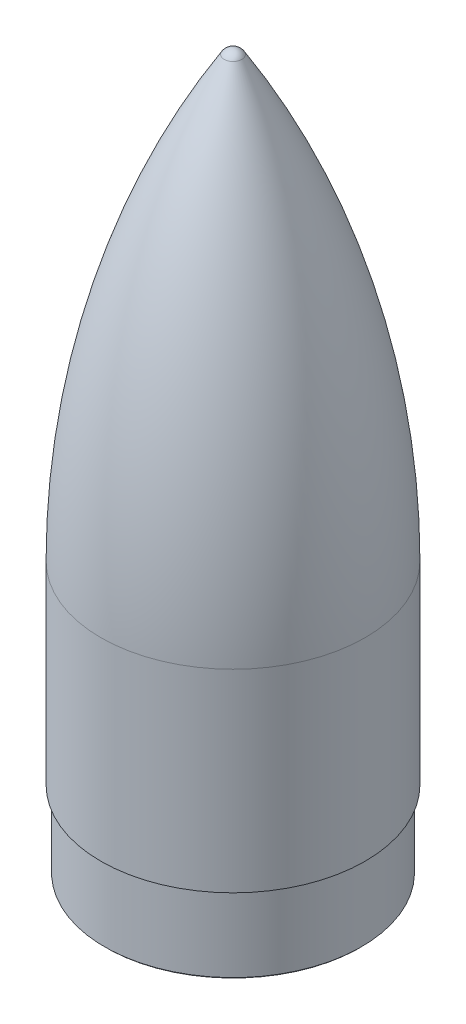
from build123d import *

# Parameters (mm, degrees)
FILLET_751_R                = 3
CHAMFER_848_SIZE            = 0.5
CUT_EXTRUDE_1153_REACH      = 288.307
CUT_EXTRUDE_1153_END_RADIUS = 51.2


# Read off the part's stored shape, not the designer's step: Оболочка1
with BuildPart() as part:
    # Эскиз1 → Revolve 638 (revolve)
    with BuildSketch(Plane.XY, mode=Mode.PRIVATE) as revolve_638_sk:
        with BuildLine():
            Line((49.7, 0), (30.5, 0))
            Line((30.5, 0), (30.5, 155))
            Line((30.5, 155), (26.5, 167))
            Line((26.5, 167), (0, 167))
            Line((0, 167), (0, 277))
            ThreePointArc((0, 277), (1.957966055, 276.488032243), (3.414724365, 275.083184464))
            ThreePointArc((3.414724365, 275.083184464), (39.026806742, 193.334198085), (51.2, 105))
            Line((51.2, 105), (51.2, 30))
            Line((51.2, 30), (49.7, 30))
            Line((49.7, 30), (49.7, 0))
        make_face()
    revolve(revolve_638_sk.sketch.rotate(Axis((0, 0, 0), (0, 1, 0)), 90), axis=Axis((0, 0, 0), (0, 1, 0)))

    # Оболочка1 outline → Оболочка1 (revolve, cut)
    with BuildSketch(Plane.XY):
        with BuildLine():
            ThreePointArc((48.2, 105), (36.138629997, 192.522757951), (0.853681091, 273.520796115))
            ThreePointArc((0.853681091, 273.520796115), (0.489491514, 273.872008061), (0, 274))
            Line((0, 274), (0, 167))
            Line((0, 167), (26.5, 167))
            Line((26.5, 167), (30.5, 155))
            Line((30.5, 155), (30.5, 0))
            Line((30.5, 0), (46.7, 0))
            Line((46.7, 0), (46.7, 33))
            Line((46.7, 33), (48.2, 33))
            Line((48.2, 33), (48.2, 105))
        make_face()
    revolve(axis=Axis((0, 0, 0), (0, 1, 0)), mode=Mode.SUBTRACT)

    # Fillet 751
    # the kernel refuses this fillet: 3 mm, written as the material it adds along each edge
    with BuildSketch(Plane(origin=(0, 33, 0), x_dir=(1, 0, 0), z_dir=(0, 0, 1))) as fillet_751_piece_1:
        with BuildLine():
            CenterArc((45.2, 2.598076211), FILLET_751_R, 300, 60)
            Line((48.2, 2.598076211), (48.26, 2.598076211))
            Line((48.26, 2.598076211), (48.26, 0))
            Line((48.26, 0), (48.2, -0.06))
            ThreePointArc((48.2, -0.06), (47.45, -0.06), (46.73, -0.051961524))
            Line((46.73, -0.051961524), (46.7, 0))
        make_face()
    revolve(axis=Axis((0, 33, 0), (0, 1, 0)))

    # Chamfer 848
    chamfer_848_edges = [part.edges().sort_by_distance(p)[0] for p in [
        (0, 0, 49.7),
    ]]
    chamfer(chamfer_848_edges, length=CHAMFER_848_SIZE)

    # Cut-Extrude 1153: up to this cylinder (the profile starts inside it)
    cut_extrude_1153_end = Plane(origin=(0, 50.452653, 0), z_dir=(0, -1, 0)) * Cylinder(CUT_EXTRUDE_1153_END_RADIUS, 680.014, mode=Mode.PRIVATE)
    # Эскиз4 → Cut-Extrude 1153 (cut, up to the surface)
    with BuildSketch(Plane(origin=(0, 0, 0), x_dir=(0, 0, -1), z_dir=(1, 0, 0)), mode=Mode.PRIVATE) as cut_extrude_1153_sk1:
        with BuildLine():
            Line((-1.732050808, 51), (0, 54))
            Line((0, 54), (1.732050808, 51))
            ThreePointArc((1.732050808, 51), (0, 48), (-1.732050808, 51))
        make_face()
    cut_extrude_1153_tool1 = extrude(cut_extrude_1153_sk1.sketch, amount=-CUT_EXTRUDE_1153_REACH, mode=Mode.PRIVATE) & cut_extrude_1153_end
    add(cut_extrude_1153_tool1.solids().sort_by_distance((0, 50.452653, 0))[0], mode=Mode.SUBTRACT)


solid = part.part
